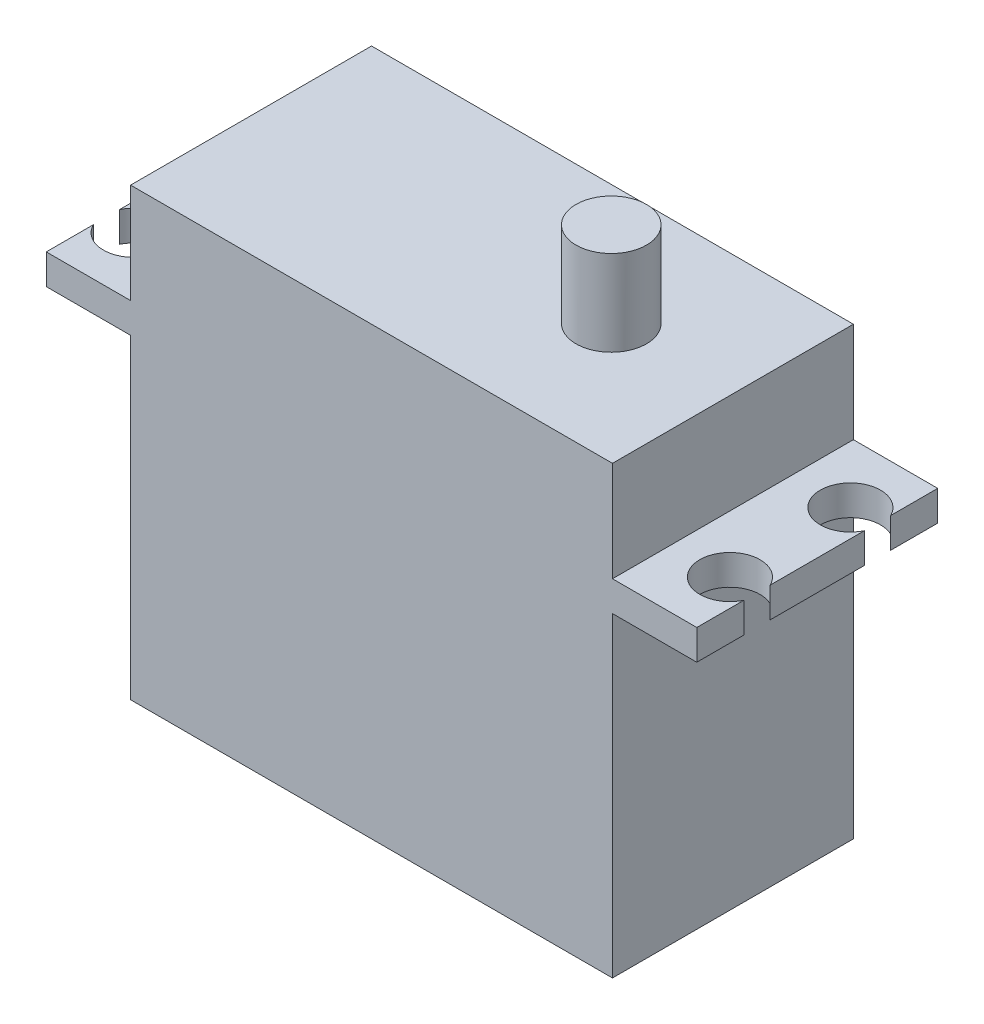
from build123d import *

# Parameters (mm, degrees)
SKETCH2_W           = 40
SKETCH2_H           = 20
BOSS_EXTRUDE1_DEPTH = 37
SKETCH3_W           = 20
SKETCH3_H           = 2.5
BOSS_EXTRUDE2_DEPTH = 7
SKETCH4_R           = 2.5
CUT_EXTRUDE5_DEPTH  = 7.25
SKETCH5_R           = 2.925
BOSS_EXTRUDE4_DEPTH = 7.1


with BuildPart() as part:
    # Sketch2 → Boss-Extrude1 (new body)
    with BuildSketch(Plane(origin=(0, 0, 0), x_dir=(1, 0, 0), z_dir=(0, 1, 0))):
        with Locations((20, 10)):
            Rectangle(SKETCH2_W, SKETCH2_H)
    extrude(amount=BOSS_EXTRUDE1_DEPTH)

    # Sketch3 → Boss-Extrude2 (add)
    with BuildSketch(Plane.ZY):
        with Locations((-10, 27.45)):
            Rectangle(SKETCH3_W, SKETCH3_H)
    boss_extrude2 = extrude(amount=BOSS_EXTRUDE2_DEPTH)

    # Mirror1: Boss-Extrude2 across plane
    add(boss_extrude2.mirror(Plane.ZY.offset(-20)))

    # Sketch4 → Cut-Extrude5 (cut)
    with BuildSketch(Plane(origin=(0, 28.7, 0), x_dir=(1, 0, 0), z_dir=(0, 1, 0))):
        with Locations((-4.75, 15)):
            Circle(SKETCH4_R)
        with Locations((-4.75, 5)):
            Circle(SKETCH4_R)
        with Locations((44.75, 5)):
            Circle(SKETCH4_R)
        with Locations((44.75, 15)):
            Circle(SKETCH4_R)
    extrude(amount=-CUT_EXTRUDE5_DEPTH, mode=Mode.SUBTRACT)

    # Sketch5 → Boss-Extrude4 (add)
    with BuildSketch(Plane(origin=(0, 37, 0), x_dir=(1, 0, 0), z_dir=(0, 1, 0))):
        with Locations((29.9, 10)):
            Circle(SKETCH5_R)
    extrude(amount=BOSS_EXTRUDE4_DEPTH)


solid = part.part
